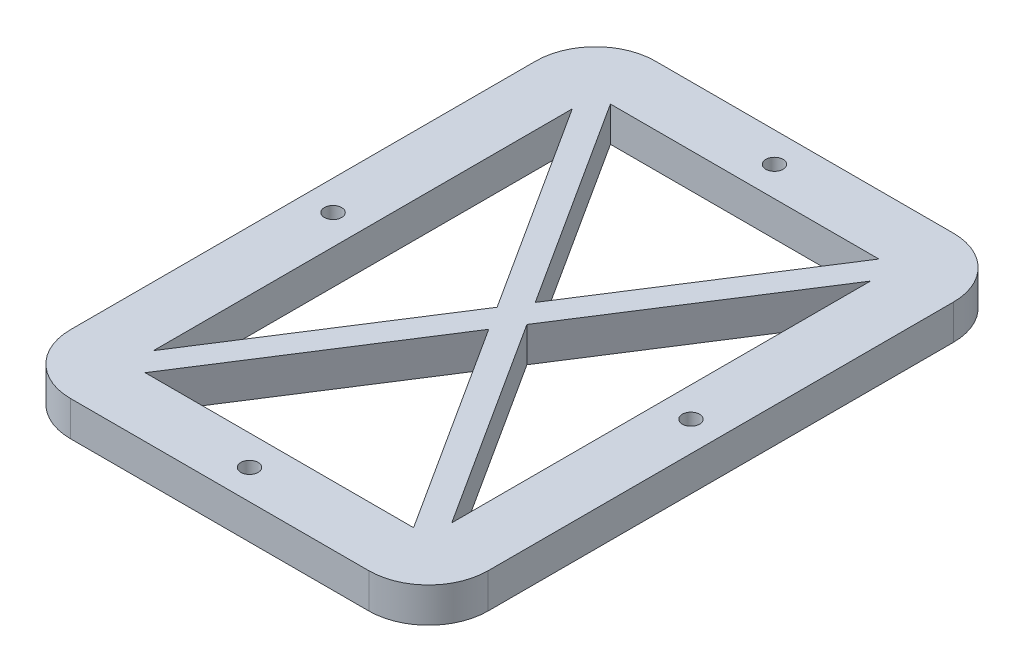
from build123d import *

# Parameters (mm, degrees)
SKETCH1_R           = 1.45
BOSS_EXTRUDE1_DEPTH = 5.85


with BuildPart() as part:
    # Sketch1 → Boss-Extrude1 (new body)
    with BuildSketch(Plane(origin=(0, 0, 0), x_dir=(1, 0, 0), z_dir=(0, 1, 0))):
        with BuildLine():
            ThreePointArc((-25, 49), (-32.071067812, 46.071067812), (-35, 39))
            Line((-35, 39), (-35, -39))
            ThreePointArc((-35, -39), (-32.071067812, -46.071067812), (-25, -49))
            Line((-25, -49), (25, -49))
            ThreePointArc((25, -49), (32.071067812, -46.071067812), (35, -39))
            Line((35, -39), (35, 39))
            ThreePointArc((35, 39), (32.071067812, 46.071067812), (25, 49))
            Line((25, 49), (-25, 49))
        make_face()
        with Locations((0, -44)):
            Circle(SKETCH1_R, mode=Mode.SUBTRACT)
        with Locations((-30, 0)):
            Circle(SKETCH1_R, mode=Mode.SUBTRACT)
        with Locations((30, 0)):
            Circle(SKETCH1_R, mode=Mode.SUBTRACT)
        Polygon((22.5, -39), (-22.5, -39), (0, -3.9), align=None, mode=Mode.SUBTRACT)
        Polygon((25, 35.1), (25, -35.1), (2.5, 0), align=None, mode=Mode.SUBTRACT)
        Polygon((-22.5, 39), (22.5, 39), (0, 3.9), align=None, mode=Mode.SUBTRACT)
        Polygon((-25, -35.1), (-25, 35.1), (-2.5, 0), align=None, mode=Mode.SUBTRACT)
        with Locations((0, 44)):
            Circle(SKETCH1_R, mode=Mode.SUBTRACT)
    extrude(amount=BOSS_EXTRUDE1_DEPTH)


solid = part.part
